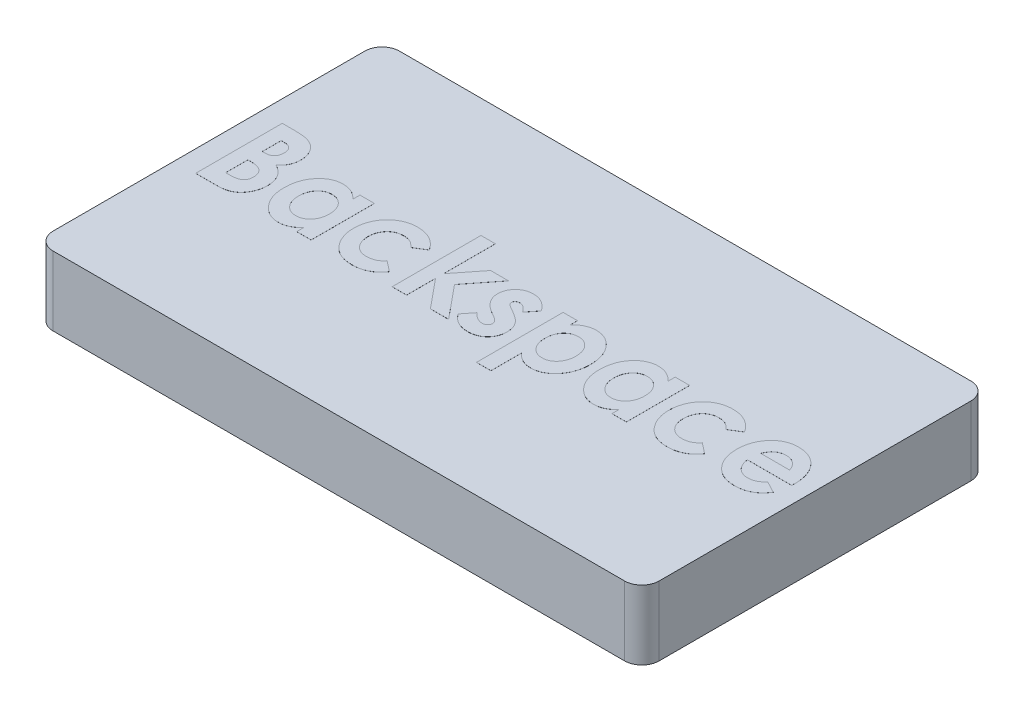
from build123d import *

# Parameters (mm, degrees)
SKETCH1_W           = 22.225
SKETCH1_H           = 12.7
BOSS_EXTRUDE1_DEPTH = 2.54
FILLET1_R           = 0.635
SHELL1_START        = 0.635
SHELL1_OUTLINE_W    = 1.905
SHELL1_OUTLINE_H    = 11.43
SHELL1_DEPTH        = 20.955
SKETCH2_R           = 2.54
BOSS_EXTRUDE2_DEPTH = 1.905
BOSS_EXTRUDE3_DEPTH = 0.00254


# Read off the part's stored shape, not the designer's step: Shell1
with BuildPart() as part:
    # Sketch1 → Boss-Extrude1 (new body)
    with BuildSketch(Plane(origin=(0, 0, 0), x_dir=(1, 0, 0), z_dir=(0, 1, 0))):
        with Locations((11.1125, 6.35)):
            Rectangle(SKETCH1_W, SKETCH1_H)
    extrude(amount=BOSS_EXTRUDE1_DEPTH)

    # Fillet1
    fillet1_edges = [part.edges().sort_by_distance(p)[0] for p in [
        (0, 1.27, -12.7),
        (22.225, 1.27, -12.7),
        (22.225, 1.27, 0),
        (0, 1.27, 0),
    ]]
    fillet(fillet1_edges, radius=FILLET1_R)

    # Shell1 outline → Shell1 (cut)
    with BuildSketch(Plane.YZ.offset(SHELL1_START)):
        with Locations((0.9525, -6.35)):
            Rectangle(SHELL1_OUTLINE_W, SHELL1_OUTLINE_H)
    extrude(amount=SHELL1_DEPTH, mode=Mode.SUBTRACT)

    # Sketch2 → Boss-Extrude2 (add)
    with BuildSketch(Plane(origin=(0, 1.905, 0), x_dir=(-1, 0, 0), z_dir=(0, -1, 0))):
        with Locations(Location((-11.1125, 6.35, 0), (0, 0, 270))):
            Circle(SKETCH2_R)
    extrude(amount=BOSS_EXTRUDE2_DEPTH)

    # Sketch3 → Boss-Extrude3 (add)
    # profile 1 of 9: a face of its own
    with BuildSketch(Plane(origin=(0, 2.54, 0), x_dir=(1, 0, 0), z_dir=(0, 1, 0))):
        with BuildLine():
            Line((0.782841026, 5.08), (0.782841026, 8.255))
            Line((0.782841026, 8.255), (1.210880889, 8.255))
            add(Edge.make_bspline(
                [(1.210880889, 8.255), (1.240777619, 8.255005299), (1.298682144, 8.255015562), (1.382433108, 8.251490649), (1.460032164, 8.24705343), (1.531400749, 8.241896839), (1.596237886, 8.233275143), (1.654880836, 8.224061028), (1.707424578, 8.212855682), (1.739890352, 8.203051523), (1.755311979, 8.198394431)],
                knots=[0, 0, 0, 0, 1.306173942, 2.529821229, 3.661816241, 4.702662712, 5.655173924, 6.518661075, 7.296346443, 8, 8, 8, 8], degree=3))
            add(Edge.make_bspline(
                [(1.755311979, 8.198394431), (1.775378974, 8.191761779), (1.815100305, 8.17863287), (1.871694748, 8.152779306), (1.925325043, 8.123542034), (1.975933674, 8.09038805), (2.023188901, 8.052690357), (2.067027311, 8.010556231), (2.107859777, 7.964618195), (2.145300553, 7.915076365), (2.179021792, 7.862397554), (2.208190527, 7.807004793), (2.233225936, 7.749441384), (2.253603181, 7.689442542), (2.269361457, 7.627107805), (2.281082703, 7.562541121), (2.287168388, 7.49549961), (2.288336777, 7.45002413), (2.288930769, 7.426905048)],
                knots=[0, 0, 0, 0, 1.006077387, 1.991465713, 2.958625327, 3.913741727, 4.869498573, 5.833754035, 6.806591121, 7.794253741, 8.788759311, 9.782598099, 10.773147723, 11.775925239, 12.79729435, 13.833335922, 14.898499088, 16, 16, 16, 16], degree=3))
            add(Edge.make_bspline(
                [(2.288930769, 7.426905048), (2.288040631, 7.39718231), (2.28629014, 7.338731427), (2.273528154, 7.253121297), (2.251604236, 7.171759959), (2.221780494, 7.094017306), (2.181619892, 7.01948078), (2.130133731, 6.948503065), (2.06868991, 6.87884065), (2.021028113, 6.836808266), (1.99636266, 6.81505609)],
                knots=[0, 0, 0, 0, 1.015106322, 1.996244851, 2.948330454, 3.888359469, 4.834477556, 5.831206681, 6.877627938, 8, 8, 8, 8], degree=3))
            add(Edge.make_bspline(
                [(1.99636266, 6.81505609), (2.01728017, 6.803638754), (2.058283763, 6.781257897), (2.116220076, 6.744208913), (2.170036627, 6.705243415), (2.219582485, 6.664266385), (2.264240142, 6.620501045), (2.305352535, 6.575464426), (2.341536564, 6.527647902), (2.384093827, 6.461182911), (2.428156869, 6.371795087), (2.465640754, 6.255730066), (2.488266045, 6.13030481), (2.491032024, 6.043663072), (2.49245641, 5.999045473)],
                knots=[0, 0, 0, 0, 0.848330169, 1.662940995, 2.446604048, 3.213062646, 3.94976172, 4.671337991, 5.382453488, 6.081852935, 7.479510686, 8.916609095, 10.412156767, 12, 12, 12, 12], degree=3))
            add(Edge.make_bspline(
                [(2.49245641, 5.999045473), (2.491001988, 5.955694962), (2.488137531, 5.870316927), (2.465068408, 5.74535742), (2.428358375, 5.625894161), (2.376122763, 5.514320913), (2.313255723, 5.412188276), (2.240350205, 5.322906174), (2.158682092, 5.247336085), (2.083045472, 5.19583697), (2.017531748, 5.161221546), (1.963188576, 5.140429763), (1.905388008, 5.120542355), (1.842316054, 5.106702516), (1.775371881, 5.094248061), (1.703519722, 5.086343871), (1.627549321, 5.081159803), (1.575328345, 5.080392591), (1.54860625, 5.08)],
                knots=[0, 0, 0, 0, 1.393430134, 2.744335056, 4.072854928, 5.403001208, 6.695348278, 7.921150692, 9.098605395, 10.261737545, 10.853399442, 11.477641282, 12.130997377, 12.817392161, 13.551699353, 14.320526973, 15.140593641, 16, 16, 16, 16], degree=3))
            Line((1.54860625, 5.08), (0.782841026, 5.08))
        make_face()
        with BuildLine():
            Line((1.312007692, 7.685128205), (1.312007692, 6.993141026))
            Line((1.312007692, 6.993141026), (1.416314583, 6.993141026))
            add(Edge.make_bspline(
                [(1.416314583, 6.993141026), (1.443582456, 6.993969477), (1.495230197, 6.995538638), (1.56700513, 7.0143817), (1.628359246, 7.044182307), (1.677153799, 7.08763855), (1.714438779, 7.141083893), (1.741364004, 7.203326853), (1.757323201, 7.274315456), (1.758926796, 7.32442076), (1.759764103, 7.350582933)],
                knots=[0, 0, 0, 0, 1.155430212, 2.188486046, 3.126777521, 4.026378417, 4.930788485, 5.874336536, 6.890098034, 8, 8, 8, 8], degree=3))
            add(Edge.make_bspline(
                [(1.759764103, 7.350582933), (1.758922189, 7.37506427), (1.757314992, 7.421798689), (1.741491405, 7.487772571), (1.717045944, 7.546484769), (1.680734962, 7.596127598), (1.634535945, 7.63699427), (1.57703764, 7.6658644), (1.508999216, 7.682196407), (1.460505483, 7.684111461), (1.434759095, 7.685128205)],
                knots=[0, 0, 0, 0, 1.104467184, 2.108407364, 3.048166969, 3.960368024, 4.863467067, 5.810427255, 6.837507733, 8, 8, 8, 8], degree=3))
            Line((1.434759095, 7.685128205), (1.312007692, 7.685128205))
        make_face(mode=Mode.SUBTRACT)
        with BuildLine():
            Line((1.312007692, 6.463974359), (1.312007692, 5.649871795))
            Line((1.312007692, 5.649871795), (1.436667147, 5.649871795))
            add(Edge.make_bspline(
                [(1.436667147, 5.649871795), (1.461477591, 5.650057719), (1.509234685, 5.650415601), (1.577623151, 5.654723602), (1.639588912, 5.66244291), (1.695173814, 5.672227111), (1.744602819, 5.685548736), (1.787704497, 5.701829342), (1.824821537, 5.720770319), (1.864707512, 5.750683762), (1.904926069, 5.796451849), (1.939905512, 5.861843674), (1.959474495, 5.938592434), (1.961974247, 5.992786445), (1.963289744, 6.02130609)],
                knots=[0, 0, 0, 0, 1.201938101, 2.313585023, 3.317513301, 4.226117985, 5.045907792, 5.793682433, 6.455296173, 7.057208093, 8.199375751, 9.375762321, 10.61899269, 12, 12, 12, 12], degree=3))
            add(Edge.make_bspline(
                [(1.963289744, 6.02130609), (1.962931949, 6.038068754), (1.962236778, 6.070637464), (1.956592821, 6.118195259), (1.946257978, 6.162861109), (1.932449761, 6.204930535), (1.914421826, 6.24412627), (1.892677577, 6.280586097), (1.867068035, 6.314675694), (1.837038462, 6.345923889), (1.802469335, 6.374279821), (1.762576145, 6.398433058), (1.717557708, 6.418981222), (1.667043978, 6.435011463), (1.611685667, 6.448754627), (1.55091283, 6.456955118), (1.485129161, 6.463074936), (1.439440101, 6.463666634), (1.415678566, 6.463974359)],
                knots=[0, 0, 0, 0, 0.998956311, 1.940903783, 2.848228916, 3.72731047, 4.57542379, 5.414071263, 6.253099421, 7.111039485, 7.991210135, 8.910076193, 9.882630836, 10.933540472, 12.064436671, 13.277812942, 14.584270601, 16, 16, 16, 16], degree=3))
            Line((1.415678566, 6.463974359), (1.312007692, 6.463974359))
        make_face(mode=Mode.SUBTRACT)
    # profile 2 of 9: a face of its own
    with BuildSketch(Plane(origin=(0, 2.54, 0), x_dir=(1, 0, 0), z_dir=(0, 1, 0))):
        with BuildLine():
            Line((4.487007692, 7.400192308), (5.016174359, 7.400192308))
            Line((5.016174359, 7.400192308), (5.016174359, 5.08))
            Line((5.016174359, 5.08), (4.487007692, 5.08))
            Line((4.487007692, 5.08), (4.487007692, 5.333135016))
            add(Edge.make_bspline(
                [(4.487007692, 5.333135016), (4.461957623, 5.308541962), (4.413554915, 5.261022318), (4.336839144, 5.198859237), (4.259878271, 5.147882497), (4.182591238, 5.10663709), (4.103107734, 5.076732789), (4.021157519, 5.054757072), (3.935768552, 5.041993825), (3.877743853, 5.040200406), (3.848445994, 5.039294872)],
                knots=[0, 0, 0, 0, 1.163382011, 2.247931421, 3.267489461, 4.220113468, 5.145617393, 6.076497093, 7.028783948, 8, 8, 8, 8], degree=3))
            add(Edge.make_bspline(
                [(3.848445994, 5.039294872), (3.815293717, 5.040118195), (3.749831385, 5.041743924), (3.653712509, 5.059369906), (3.560934853, 5.085712858), (3.471764687, 5.123773665), (3.386307179, 5.172616557), (3.303494533, 5.231459579), (3.224921576, 5.301881217), (3.150214437, 5.381525338), (3.082188509, 5.469309774), (3.021767964, 5.563094804), (2.971677952, 5.662873434), (2.930119356, 5.767294668), (2.898226951, 5.877020546), (2.875555639, 5.99193579), (2.861099231, 6.112099948), (2.859575806, 6.194049189), (2.858802564, 6.23564403)],
                knots=[0, 0, 0, 0, 0.921835666, 1.820252405, 2.711136546, 3.602274754, 4.511404282, 5.446462619, 6.424679939, 7.443427837, 8.482233586, 9.511947504, 10.543891267, 11.584974293, 12.636376529, 13.719674099, 14.842578722, 16, 16, 16, 16], degree=3))
            add(Edge.make_bspline(
                [(2.858802564, 6.23564403), (2.859618591, 6.278717935), (2.861218556, 6.363171938), (2.874921209, 6.486929535), (2.896829697, 6.604852641), (2.92820161, 6.716481882), (2.967588437, 6.822541777), (3.016801072, 6.922194511), (3.0739736, 7.016642393), (3.140985028, 7.103029925), (3.213183852, 7.18216236), (3.290374932, 7.251161012), (3.371212259, 7.309836407), (3.456041699, 7.357870386), (3.545186722, 7.394914788), (3.637723303, 7.421713272), (3.73421716, 7.438259131), (3.799830325, 7.440008321), (3.833181571, 7.440897436)],
                knots=[0, 0, 0, 0, 1.196863731, 2.346662879, 3.456089904, 4.526915168, 5.565529373, 6.595904008, 7.611531943, 8.628611739, 9.629449148, 10.585123154, 11.500947365, 12.400650051, 13.288132989, 14.177647946, 15.073696393, 16, 16, 16, 16], degree=3))
            add(Edge.make_bspline(
                [(3.833181571, 7.440897436), (3.863989164, 7.440184959), (3.924905693, 7.438776162), (4.014363738, 7.423217123), (4.10107294, 7.399931913), (4.184596485, 7.366237755), (4.26602107, 7.324669947), (4.342918384, 7.271333921), (4.418319016, 7.21056496), (4.463766751, 7.163074571), (4.487007692, 7.138789063)],
                knots=[0, 0, 0, 0, 0.995162038, 1.96775565, 2.927337147, 3.893531728, 4.874688255, 5.876697576, 6.914191259, 8, 8, 8, 8], degree=3))
            Line((4.487007692, 7.138789063), (4.487007692, 7.400192308))
        make_face()
        with BuildLine():
            add(Edge.make_bspline(
                [(3.952752885, 6.911730769), (3.933013307, 6.911012599), (3.894000493, 6.909593224), (3.83672326, 6.901572449), (3.781856602, 6.886716125), (3.729998703, 6.865581037), (3.680178444, 6.839470208), (3.633704796, 6.806388171), (3.58904503, 6.768438825), (3.547944573, 6.7244873), (3.510719843, 6.676230395), (3.477004137, 6.624771171), (3.450309659, 6.569003151), (3.426576592, 6.510904872), (3.410034189, 6.448813873), (3.397034749, 6.383645573), (3.389407937, 6.315114489), (3.388453709, 6.268311132), (3.387969231, 6.244548277)],
                knots=[0, 0, 0, 0, 0.969811408, 1.916711318, 2.833650388, 3.754071331, 4.662456234, 5.589743238, 6.549778185, 7.536877355, 8.538750444, 9.541056354, 10.551604298, 11.570646859, 12.619111342, 13.70146669, 14.832995853, 16, 16, 16, 16], degree=3))
            add(Edge.make_bspline(
                [(3.387969231, 6.244548277), (3.388446876, 6.22057141), (3.389387751, 6.17334124), (3.397114321, 6.104207762), (3.409771445, 6.038237886), (3.427643681, 5.975665856), (3.450425888, 5.91605871), (3.479205442, 5.860243737), (3.512679668, 5.807501972), (3.550294561, 5.758277743), (3.592258401, 5.713953966), (3.636703501, 5.674783273), (3.684225871, 5.642130049), (3.733970955, 5.615412925), (3.785660503, 5.594069081), (3.839956301, 5.579459526), (3.896477827, 5.570383944), (3.935122267, 5.569107108), (3.954660937, 5.568461538)],
                knots=[0, 0, 0, 0, 1.168729735, 2.302189922, 3.386710167, 4.440198422, 5.470978749, 6.492597328, 7.496227051, 8.513391371, 9.50782408, 10.467539671, 11.396482034, 12.312160972, 13.216215124, 14.11642033, 15.047660069, 16, 16, 16, 16], degree=3))
            add(Edge.make_bspline(
                [(3.954660937, 5.568461538), (3.974826009, 5.569165967), (4.014476233, 5.570551072), (4.072780347, 5.578711312), (4.128533825, 5.593366018), (4.181269044, 5.61454245), (4.231519168, 5.641023378), (4.279532104, 5.672632016), (4.324032517, 5.711415602), (4.366009246, 5.755078383), (4.403771647, 5.803787045), (4.437205744, 5.856277018), (4.465261387, 5.912574407), (4.488059067, 5.972482073), (4.505990018, 6.035898998), (4.51855197, 6.102946401), (4.526320675, 6.17355483), (4.527242803, 6.221843247), (4.527712821, 6.24645633)],
                knots=[0, 0, 0, 0, 0.973494368, 1.914164832, 2.835034228, 3.749055219, 4.650792206, 5.573195486, 6.516644894, 7.49373616, 8.49266101, 9.486277843, 10.493086248, 11.523132543, 12.575953654, 13.669751989, 14.812249585, 16, 16, 16, 16], degree=3))
            add(Edge.make_bspline(
                [(4.527712821, 6.24645633), (4.527251134, 6.270646138), (4.526349638, 6.317879453), (4.518522887, 6.387007312), (4.505867123, 6.45274862), (4.488317428, 6.515024642), (4.465114032, 6.573533546), (4.437015791, 6.628486609), (4.403982613, 6.680198608), (4.365764786, 6.727699544), (4.324076466, 6.770763522), (4.279322172, 6.808802464), (4.231391282, 6.840553988), (4.181042153, 6.86708282), (4.127609235, 6.886484715), (4.071982738, 6.901661053), (4.013188548, 6.909600398), (3.973125303, 6.911012637), (3.952752885, 6.911730769)],
                knots=[0, 0, 0, 0, 1.177928123, 2.300036839, 3.38351634, 4.435993631, 5.446552242, 6.444100992, 7.438062291, 8.429875644, 9.408429948, 10.353784422, 11.284588866, 12.203691864, 13.118608642, 14.047865231, 15.007326911, 16, 16, 16, 16], degree=3))
        make_face(mode=Mode.SUBTRACT)
    # profile 3 of 9: a face of its own
    with BuildSketch(Plane(origin=(0, 2.54, 0), x_dir=(1, 0, 0), z_dir=(0, 1, 0))):
        with BuildLine():
            Line((7.499187179, 6.926995192), (7.081959615, 6.6675))
            add(Edge.make_bspline(
                [(7.081959615, 6.6675), (7.06287843, 6.689114788), (7.026397653, 6.730439488), (6.967386507, 6.783222067), (6.909619485, 6.826868422), (6.850283446, 6.859276876), (6.789158517, 6.883405862), (6.723948059, 6.899750223), (6.654047099, 6.910197902), (6.605621553, 6.911211012), (6.580777724, 6.911730769)],
                knots=[0, 0, 0, 0, 1.194303875, 2.283355759, 3.276580192, 4.189182302, 5.077070842, 5.993727104, 6.970718852, 8, 8, 8, 8], degree=3))
            add(Edge.make_bspline(
                [(6.580777724, 6.911730769), (6.557848362, 6.911116331), (6.513083846, 6.909916776), (6.447523274, 6.900620316), (6.385146921, 6.886391524), (6.326154245, 6.865358745), (6.27103274, 6.83739963), (6.218767081, 6.80454651), (6.169928676, 6.765254464), (6.125217737, 6.720242811), (6.084602712, 6.670931043), (6.049270691, 6.61761034), (6.019670371, 6.560974004), (5.99419656, 6.501223792), (5.975487168, 6.437775347), (5.962211721, 6.370919968), (5.953611603, 6.300954393), (5.952803871, 6.253054319), (5.952392308, 6.228647837)],
                knots=[0, 0, 0, 0, 1.055507124, 2.060644499, 3.04339101, 3.997597527, 4.936295645, 5.88423876, 6.835644371, 7.815914652, 8.800937668, 9.77300634, 10.755607363, 11.740146458, 12.759408235, 13.795227115, 14.876603977, 16, 16, 16, 16], degree=3))
            add(Edge.make_bspline(
                [(5.952392308, 6.228647837), (5.952841785, 6.204878426), (5.953719106, 6.158483697), (5.961732873, 6.090460999), (5.973871974, 6.025564442), (5.992942783, 5.964342285), (6.015221552, 5.905929954), (6.044729502, 5.851795771), (6.077300196, 5.799778123), (6.116316532, 5.752303279), (6.159245932, 5.709400888), (6.205387882, 5.671249023), (6.255063724, 5.639255877), (6.308356329, 5.614086162), (6.364172437, 5.593235489), (6.423472182, 5.578644058), (6.486210815, 5.570537629), (6.529025665, 5.569163238), (6.550884896, 5.568461538)],
                knots=[0, 0, 0, 0, 1.138892009, 2.222965831, 3.27924816, 4.298360244, 5.292854937, 6.27022401, 7.248385224, 8.230812959, 9.208076365, 10.154034703, 11.095561274, 12.031863364, 12.973883383, 13.947441211, 14.952060877, 16, 16, 16, 16], degree=3))
            add(Edge.make_bspline(
                [(6.550884896, 5.568461538), (6.577853097, 5.569154587), (6.630559431, 5.570509073), (6.707332432, 5.582257036), (6.779552129, 5.601095083), (6.847025809, 5.628091944), (6.909879926, 5.662644601), (6.968042248, 5.705085228), (7.022127004, 5.754668431), (7.052971091, 5.793176138), (7.068603245, 5.812692308)],
                knots=[0, 0, 0, 0, 1.087586428, 2.125566055, 3.125668057, 4.09304163, 5.050187411, 6.011795079, 6.992353802, 8, 8, 8, 8], degree=3))
            Line((7.068603245, 5.812692308), (7.458482051, 5.508675881))
            add(Edge.make_bspline(
                [(7.458482051, 5.508675881), (7.4311692, 5.471272245), (7.377656557, 5.397989256), (7.283649294, 5.302176395), (7.182184004, 5.22032791), (7.071419963, 5.154489347), (6.952772246, 5.102333638), (6.825545439, 5.065619419), (6.690080059, 5.043728109), (6.597184531, 5.040796265), (6.549612861, 5.039294872)],
                knots=[0, 0, 0, 0, 1.039868462, 2.037359943, 3.00707792, 3.962440096, 4.924824084, 5.912581365, 6.931035832, 8, 8, 8, 8], degree=3))
            add(Edge.make_bspline(
                [(6.549612861, 5.039294872), (6.506736973, 5.040406872), (6.422986679, 5.042578962), (6.301001357, 5.059129209), (6.186203064, 5.087383774), (6.078194815, 5.125878712), (5.977487227, 5.176383546), (5.88468875, 5.23900043), (5.798319812, 5.311532118), (5.720639852, 5.395051066), (5.651220979, 5.485759156), (5.589940268, 5.580865492), (5.538848776, 5.68029887), (5.496728314, 5.783072509), (5.463280715, 5.889809558), (5.44008379, 6.000568258), (5.425542647, 6.115047596), (5.424004689, 6.192562827), (5.423225641, 6.231827925)],
                knots=[0, 0, 0, 0, 1.119149545, 2.186056245, 3.206287529, 4.200745281, 5.173526272, 6.139100442, 7.117079434, 8.111660401, 9.110222197, 10.095923489, 11.061354878, 12.024435272, 12.992528438, 13.977125808, 14.975319392, 16, 16, 16, 16], degree=3))
            add(Edge.make_bspline(
                [(5.423225641, 6.231827925), (5.423817271, 6.259186734), (5.424988312, 6.313339252), (5.431225321, 6.393876944), (5.442649625, 6.472928277), (5.459353538, 6.550119742), (5.4797376, 6.625763659), (5.504475879, 6.699810452), (5.534491298, 6.772139181), (5.568676598, 6.842779748), (5.607419047, 6.910376316), (5.64934662, 6.974973978), (5.695260047, 7.035551932), (5.744949481, 7.092140992), (5.798107884, 7.145191667), (5.854413147, 7.195042872), (5.915387291, 7.239900928), (5.978690076, 7.282175305), (6.045301313, 7.319463036), (6.114139617, 7.352010138), (6.184907435, 7.37950188), (6.257714256, 7.401526166), (6.332115274, 7.419850066), (6.408782499, 7.431356687), (6.487106887, 7.439533869), (6.540050574, 7.440439914), (6.566785337, 7.440897436)],
                knots=[0, 0, 0, 0, 1.060056762, 2.098217867, 3.127372312, 4.151927895, 5.156132648, 6.161311037, 7.174111614, 8.187977387, 9.199611623, 10.190595683, 11.169662846, 12.141676319, 13.105780171, 14.077793643, 15.051921661, 16.036040289, 17.025286885, 18.006281483, 18.984004081, 19.963484586, 20.951605312, 21.949508978, 22.964571759, 24, 24, 24, 24], degree=3))
            add(Edge.make_bspline(
                [(6.566785337, 7.440897436), (6.5916029, 7.440579147), (6.640686558, 7.439949642), (6.71314846, 7.43349609), (6.783602599, 7.422485466), (6.852189472, 7.407870109), (6.919360825, 7.389747031), (6.983995716, 7.365989225), (7.046752815, 7.338355051), (7.127907613, 7.297204846), (7.223515256, 7.235288957), (7.32814676, 7.146937624), (7.421272438, 7.043812951), (7.472986621, 6.966277753), (7.499187179, 6.926995192)],
                knots=[0, 0, 0, 0, 0.801484189, 1.585158681, 2.34738599, 3.103559859, 3.849525029, 4.59256119, 5.325429611, 6.063526497, 7.529967051, 8.992516966, 10.476283855, 12, 12, 12, 12], degree=3))
        make_face()
    # profile 4 of 9: a face of its own
    with BuildSketch(Plane(origin=(0, 2.54, 0), x_dir=(1, 0, 0), z_dir=(0, 1, 0))):
        Polygon((7.987648718, 8.336410256), (8.516815385, 8.336410256), (8.516815385, 6.437261619), (9.27685645, 7.400192308), (9.933226643, 7.400192308), (9.060610457, 6.294157652), (10.058522115, 5.08), (9.390067588, 5.08), (8.516815385, 6.142785457), (8.516815385, 5.08), (7.987648718, 5.08), align=None)
    # profile 5 of 9: a face of its own
    with BuildSketch(Plane(origin=(0, 2.54, 0), x_dir=(1, 0, 0), z_dir=(0, 1, 0))):
        with BuildLine():
            Line((11.488289744, 7.042114383), (11.185545353, 6.6675))
            add(Edge.make_bspline(
                [(11.185545353, 6.6675), (11.170491241, 6.686749916), (11.141748154, 6.723504128), (11.097235569, 6.773549475), (11.053360546, 6.81531515), (11.011274831, 6.850730126), (10.969372104, 6.877277451), (10.928812198, 6.897079739), (10.889019077, 6.909307116), (10.862523672, 6.910941476), (10.849728045, 6.911730769)],
                knots=[0, 0, 0, 0, 1.368660567, 2.613208372, 3.747062795, 4.759710206, 5.688691635, 6.517303616, 7.283950149, 8, 8, 8, 8], degree=3))
            add(Edge.make_bspline(
                [(10.849728045, 6.911730769), (10.836748999, 6.911308508), (10.812025254, 6.910504145), (10.776996297, 6.902636109), (10.746056971, 6.890268238), (10.720287284, 6.872078079), (10.699779402, 6.850398735), (10.684705833, 6.826000837), (10.676124194, 6.798642553), (10.674848376, 6.779710452), (10.674187179, 6.769898838)],
                knots=[0, 0, 0, 0, 1.229796002, 2.342634756, 3.388738777, 4.370994693, 5.310284858, 6.203868213, 7.06914966, 8, 8, 8, 8], degree=3))
            add(Edge.make_bspline(
                [(10.674187179, 6.769898838), (10.6757628, 6.755022975), (10.678979496, 6.724653264), (10.699232566, 6.688608774), (10.726625763, 6.661467439), (10.758215907, 6.636758636), (10.801082689, 6.609411728), (10.833344152, 6.590228235), (10.85100008, 6.579729567)],
                knots=[0, 0, 0, 0, 0.980372538, 2.001472502, 2.644932243, 3.521580606, 4.643620239, 6, 6, 6, 6], degree=3))
            Line((10.85100008, 6.579729567), (11.030993069, 6.475422676))
            add(Edge.make_bspline(
                [(11.030993069, 6.475422676), (11.05406218, 6.462132155), (11.09874096, 6.436391923), (11.160891046, 6.394413297), (11.218614839, 6.353892335), (11.270859598, 6.312958824), (11.316668407, 6.270547701), (11.357586717, 6.228822155), (11.392822203, 6.186800771), (11.43203104, 6.130371687), (11.471871777, 6.055830338), (11.504599845, 5.959084117), (11.526006774, 5.855607486), (11.527981015, 5.783970911), (11.528994872, 5.747182492)],
                knots=[0, 0, 0, 0, 1.026311994, 1.987695542, 2.890533907, 3.745971882, 4.54447292, 5.296063004, 5.998421597, 6.656110558, 7.9434731, 9.241357562, 10.583320098, 12, 12, 12, 12], degree=3))
            add(Edge.make_bspline(
                [(11.528994872, 5.747182492), (11.528415458, 5.722346137), (11.527281852, 5.673754598), (11.517438645, 5.602397052), (11.50145156, 5.534346624), (11.480088866, 5.468854383), (11.451143048, 5.406931706), (11.41589516, 5.348340999), (11.375072742, 5.292322326), (11.327318705, 5.240746669), (11.275221934, 5.193042296), (11.21765093, 5.151923597), (11.156189561, 5.116829508), (11.089825595, 5.088917361), (11.019837054, 5.066543277), (10.94528898, 5.050674279), (10.86651902, 5.041041365), (10.81244286, 5.039884886), (10.784854247, 5.039294872)],
                knots=[0, 0, 0, 0, 1.032995144, 2.021022227, 2.990285581, 3.938693397, 4.881918393, 5.827409225, 6.78011452, 7.760353803, 8.747120044, 9.714092799, 10.697699863, 11.685687568, 12.703926778, 13.750652644, 14.852426407, 16, 16, 16, 16], degree=3))
            add(Edge.make_bspline(
                [(10.784854247, 5.039294872), (10.748108205, 5.040580104), (10.676082601, 5.043099278), (10.570824806, 5.061040644), (10.47143556, 5.091750832), (10.377740108, 5.134964812), (10.289145867, 5.189659889), (10.207802827, 5.25843195), (10.130193866, 5.337166374), (10.086163651, 5.398008695), (10.063610256, 5.429173678)],
                knots=[0, 0, 0, 0, 1.030618814, 2.020107139, 2.985146026, 3.940533544, 4.907604537, 5.896019858, 6.92228791, 8, 8, 8, 8], degree=3))
            Line((10.063610256, 5.429173678), (10.368898718, 5.812692308))
            add(Edge.make_bspline(
                [(10.368898718, 5.812692308), (10.383548197, 5.794929066), (10.412626341, 5.759670332), (10.463134989, 5.713727243), (10.515621133, 5.671123563), (10.571725101, 5.635510761), (10.627963705, 5.606520123), (10.682061006, 5.585370823), (10.732862564, 5.571477924), (10.76590994, 5.569435712), (10.781674159, 5.568461538)],
                knots=[0, 0, 0, 0, 1.119500597, 2.222126707, 3.316607371, 4.407432039, 5.450634987, 6.391729787, 7.232824889, 8, 8, 8, 8], degree=3))
            add(Edge.make_bspline(
                [(10.781674159, 5.568461538), (10.797208484, 5.56897839), (10.827160572, 5.569974942), (10.869756453, 5.580228588), (10.907492009, 5.597735285), (10.939719364, 5.621411929), (10.966736488, 5.64878621), (10.985125355, 5.680028493), (10.997816887, 5.712736818), (10.999152831, 5.735616087), (10.999828205, 5.747182492)],
                knots=[0, 0, 0, 0, 1.188688593, 2.291937639, 3.331258834, 4.354844428, 5.343010125, 6.254053882, 7.117352921, 8, 8, 8, 8], degree=3))
            add(Edge.make_bspline(
                [(10.999828205, 5.747182492), (10.9992492, 5.758076978), (10.99806626, 5.780335026), (10.986919503, 5.813171399), (10.970192435, 5.846065893), (10.946289629, 5.878615159), (10.915203162, 5.910286738), (10.878061588, 5.942026088), (10.834741636, 5.974128587), (10.802427152, 5.993397987), (10.785490264, 6.003497596)],
                knots=[0, 0, 0, 0, 0.747819068, 1.527836475, 2.363222863, 3.282707394, 4.294171961, 5.411668418, 6.643385968, 8, 8, 8, 8], degree=3))
            Line((10.785490264, 6.003497596), (10.620125681, 6.09890024))
            add(Edge.make_bspline(
                [(10.620125681, 6.09890024), (10.582540788, 6.121924336), (10.510035601, 6.166340224), (10.412862444, 6.242309088), (10.330420665, 6.322767474), (10.263076766, 6.407824748), (10.209526563, 6.497057766), (10.172788775, 6.591516037), (10.14936086, 6.690109187), (10.146477883, 6.757471288), (10.145020513, 6.791523438)],
                knots=[0, 0, 0, 0, 1.198661262, 2.312342847, 3.348540627, 4.326131918, 5.257181173, 6.168868325, 7.074346411, 8, 8, 8, 8], degree=3))
            add(Edge.make_bspline(
                [(10.145020513, 6.791523438), (10.145713838, 6.813596234), (10.147072055, 6.856836565), (10.155352702, 6.920591008), (10.169862524, 6.981852745), (10.191260208, 7.040399535), (10.217349923, 7.097084218), (10.249769789, 7.151033899), (10.288552871, 7.202225401), (10.331882636, 7.250805132), (10.380024533, 7.295410215), (10.432330524, 7.333946972), (10.487298959, 7.367780588), (10.546259667, 7.394197096), (10.608124849, 7.415533165), (10.673657834, 7.429912593), (10.742198021, 7.438998534), (10.789065271, 7.440258373), (10.812839022, 7.440897436)],
                knots=[0, 0, 0, 0, 1.018774773, 1.995766957, 2.961671996, 3.91801437, 4.867928154, 5.837839166, 6.816300144, 7.827954982, 8.838947153, 9.838941932, 10.822283044, 11.811835611, 12.814364266, 13.837452721, 14.903032216, 16, 16, 16, 16], degree=3))
            add(Edge.make_bspline(
                [(10.812839022, 7.440897436), (10.845789273, 7.439685335), (10.91119089, 7.437279484), (11.00761785, 7.417592683), (11.100681628, 7.384601978), (11.190439029, 7.339299695), (11.275541216, 7.282122702), (11.354399726, 7.213389499), (11.426411015, 7.133250273), (11.467353037, 7.072950269), (11.488289744, 7.042114383)],
                knots=[0, 0, 0, 0, 0.964884164, 1.915159476, 2.870012697, 3.850705445, 4.853461725, 5.866212692, 6.908835527, 8, 8, 8, 8], degree=3))
        make_face()
    # profile 6 of 9: a face of its own
    with BuildSketch(Plane(origin=(0, 2.54, 0), x_dir=(1, 0, 0), z_dir=(0, 1, 0))):
        with BuildLine():
            Line((12.465212821, 7.400192308), (12.465212821, 7.138789063))
            add(Edge.make_bspline(
                [(12.465212821, 7.138789063), (12.488669538, 7.163073483), (12.534553561, 7.210576589), (12.610559391, 7.271394062), (12.687898474, 7.324307692), (12.769008332, 7.366415786), (12.852613323, 7.400028204), (12.939575908, 7.423125095), (13.029009954, 7.438754543), (13.089715072, 7.44017933), (13.120310978, 7.440897436)],
                knots=[0, 0, 0, 0, 1.089368188, 2.130928821, 3.137420444, 4.111338209, 5.076382318, 6.041426427, 7.012861947, 8, 8, 8, 8], degree=3))
            add(Edge.make_bspline(
                [(13.120310978, 7.440897436), (13.15366312, 7.440010458), (13.219278048, 7.438265474), (13.31575904, 7.421688938), (13.408155539, 7.395059566), (13.496951152, 7.357694395), (13.581661065, 7.309865058), (13.662448344, 7.251126604), (13.739688894, 7.182372707), (13.811200975, 7.102801405), (13.878263113, 7.016667442), (13.935477896, 6.922210165), (13.984409763, 6.822384414), (14.025032169, 6.716743853), (14.055119106, 6.604712853), (14.077378691, 6.486953194), (14.090980852, 6.363165648), (14.092594794, 6.278715811), (14.093417949, 6.23564403)],
                knots=[0, 0, 0, 0, 0.926819241, 1.823366479, 2.713376591, 3.595915486, 4.496118997, 5.412453008, 6.368658997, 7.366071271, 8.383717232, 9.399910524, 10.430858724, 11.472139475, 12.54198624, 13.652030834, 14.802470027, 16, 16, 16, 16], degree=3))
            add(Edge.make_bspline(
                [(14.093417949, 6.23564403), (14.092644705, 6.19404919), (14.091121279, 6.112099951), (14.076664885, 5.991935777), (14.053993519, 5.877020594), (14.022101311, 5.767294495), (13.980541993, 5.662874073), (13.930454649, 5.563092442), (13.870024152, 5.469318602), (13.802035427, 5.381492336), (13.727302222, 5.302115074), (13.649333895, 5.231253813), (13.566523509, 5.172645641), (13.481098529, 5.123766139), (13.391919927, 5.085714844), (13.299144406, 5.059369419), (13.203234327, 5.041782186), (13.137985895, 5.040129298), (13.105046554, 5.039294872)],
                knots=[0, 0, 0, 0, 1.158166885, 2.281794878, 3.365790304, 4.417869849, 5.459623537, 6.492232074, 7.52260933, 8.562084273, 9.581488445, 10.555926241, 11.491586939, 12.401302125, 13.2930144, 14.184472446, 15.083467941, 16, 16, 16, 16], degree=3))
            add(Edge.make_bspline(
                [(13.105046554, 5.039294872), (13.075731648, 5.040102124), (13.017850683, 5.041696006), (12.932678902, 5.055855018), (12.850109878, 5.07699642), (12.770285244, 5.108743292), (12.692494867, 5.150712019), (12.61573042, 5.203813245), (12.538489942, 5.267246933), (12.490198871, 5.316536556), (12.465212821, 5.342039263)],
                knots=[0, 0, 0, 0, 0.963305484, 1.902003389, 2.832040647, 3.761555176, 4.719117085, 5.732363383, 6.826713052, 8, 8, 8, 8], degree=3))
            Line((12.465212821, 5.342039263), (12.465212821, 4.225192308))
            Line((12.465212821, 4.225192308), (11.936046154, 4.225192308))
            Line((11.936046154, 4.225192308), (11.936046154, 7.400192308))
            Line((11.936046154, 7.400192308), (12.465212821, 7.400192308))
        make_face()
        with BuildLine():
            add(Edge.make_bspline(
                [(12.997559575, 6.911730769), (12.977398256, 6.911016558), (12.937755408, 6.909612217), (12.879397772, 6.901591543), (12.82398898, 6.886462515), (12.770666556, 6.867247787), (12.720719867, 6.840358855), (12.67288526, 6.808827525), (12.628147712, 6.770756502), (12.586454716, 6.727701481), (12.548238173, 6.680198085), (12.515204649, 6.62848675), (12.4871065, 6.573533507), (12.463903079, 6.515024653), (12.446353392, 6.452748617), (12.433697626, 6.387007313), (12.425870875, 6.317879453), (12.424969379, 6.270646138), (12.424507692, 6.24645633)],
                knots=[0, 0, 0, 0, 0.984187084, 1.935189732, 2.86617382, 3.782791437, 4.694432968, 5.626967787, 6.574079685, 7.554453132, 8.548110275, 9.543919359, 10.543322562, 11.555759812, 12.610193668, 13.695687369, 14.819882097, 16, 16, 16, 16], degree=3))
            add(Edge.make_bspline(
                [(12.424507692, 6.24645633), (12.42497771, 6.221843247), (12.425899838, 6.17355483), (12.433668542, 6.102946401), (12.446230494, 6.035898998), (12.464161446, 5.972482073), (12.486959126, 5.912574407), (12.515014769, 5.856277018), (12.548448865, 5.803787045), (12.586211267, 5.755078383), (12.628187996, 5.711415602), (12.672688409, 5.672632016), (12.720701345, 5.641023378), (12.770951469, 5.61454245), (12.823686687, 5.593366018), (12.879440166, 5.578711312), (12.93774428, 5.570551072), (12.977394504, 5.569165967), (12.997559575, 5.568461538)],
                knots=[0, 0, 0, 0, 1.187750415, 2.330248011, 3.424046346, 4.476867457, 5.506913752, 6.513722157, 7.50733899, 8.50626384, 9.483355106, 10.426804514, 11.349207794, 12.250944781, 13.164965772, 14.085835168, 15.026505632, 16, 16, 16, 16], degree=3))
            add(Edge.make_bspline(
                [(12.997559575, 5.568461538), (13.017098375, 5.569106919), (13.05574307, 5.570383382), (13.112262732, 5.579461684), (13.166565367, 5.594061271), (13.21822933, 5.615442415), (13.267917694, 5.641935628), (13.314941104, 5.675004434), (13.359331602, 5.713932671), (13.401345409, 5.75824966), (13.438742092, 5.807730219), (13.473312995, 5.859842047), (13.500797816, 5.916418386), (13.524823056, 5.975477381), (13.542374605, 6.038269592), (13.555127285, 6.104198781), (13.562827196, 6.17334361), (13.563771763, 6.220572207), (13.564251282, 6.244548277)],
                knots=[0, 0, 0, 0, 0.95256658, 1.884027947, 2.784447395, 3.688716704, 4.604613566, 5.525282879, 6.485226874, 7.47989625, 8.497302648, 9.506745809, 10.523942064, 11.558744846, 12.612483823, 13.697262175, 14.830992116, 16, 16, 16, 16], degree=3))
            add(Edge.make_bspline(
                [(13.564251282, 6.244548277), (13.563766804, 6.268311132), (13.562812576, 6.315114489), (13.555185763, 6.383645572), (13.542186326, 6.448813876), (13.525643915, 6.510904861), (13.501910874, 6.569003191), (13.475216299, 6.624771022), (13.441500954, 6.676230946), (13.404274888, 6.724485256), (13.363179299, 6.768446241), (13.318502101, 6.80636171), (13.271937784, 6.839673806), (13.221702107, 6.865394315), (13.16956577, 6.886871761), (13.11440653, 6.901467877), (13.056743643, 6.909645496), (13.017513626, 6.911027715), (12.997559575, 6.911730769)],
                knots=[0, 0, 0, 0, 1.164844956, 2.294280565, 3.374633339, 4.421157953, 5.438315082, 6.44699331, 7.447444755, 8.447464179, 9.432737018, 10.390995709, 11.316567047, 12.232458558, 13.151176538, 14.076456035, 15.021603992, 16, 16, 16, 16], degree=3))
        make_face(mode=Mode.SUBTRACT)
    # profile 7 of 9: a face of its own
    with BuildSketch(Plane(origin=(0, 2.54, 0), x_dir=(1, 0, 0), z_dir=(0, 1, 0))):
        with BuildLine():
            Line((16.047264103, 7.400192308), (16.576430769, 7.400192308))
            Line((16.576430769, 7.400192308), (16.576430769, 5.08))
            Line((16.576430769, 5.08), (16.047264103, 5.08))
            Line((16.047264103, 5.08), (16.047264103, 5.333135016))
            add(Edge.make_bspline(
                [(16.047264103, 5.333135016), (16.022214033, 5.308541962), (15.973811325, 5.261022318), (15.897095554, 5.198859237), (15.820134681, 5.147882497), (15.742847648, 5.10663709), (15.663364144, 5.076732789), (15.58141393, 5.054757072), (15.496024962, 5.041993825), (15.438000264, 5.040200406), (15.408702404, 5.039294872)],
                knots=[0, 0, 0, 0, 1.163382011, 2.247931421, 3.267489461, 4.220113468, 5.145617393, 6.076497093, 7.028783948, 8, 8, 8, 8], degree=3))
            add(Edge.make_bspline(
                [(15.408702404, 5.039294872), (15.375550127, 5.040118195), (15.310087796, 5.041743924), (15.213968919, 5.059369906), (15.121191263, 5.085712858), (15.032021097, 5.123773665), (14.946563589, 5.172616557), (14.863750943, 5.231459579), (14.785177986, 5.301881217), (14.710470847, 5.381525338), (14.64244492, 5.469309774), (14.582024375, 5.563094804), (14.531934362, 5.662873434), (14.490375766, 5.767294668), (14.458483361, 5.877020546), (14.43581205, 5.99193579), (14.421355641, 6.112099948), (14.419832217, 6.194049189), (14.419058974, 6.23564403)],
                knots=[0, 0, 0, 0, 0.921835666, 1.820252405, 2.711136546, 3.602274754, 4.511404282, 5.446462619, 6.424679939, 7.443427837, 8.482233586, 9.511947504, 10.543891267, 11.584974293, 12.636376529, 13.719674099, 14.842578722, 16, 16, 16, 16], degree=3))
            add(Edge.make_bspline(
                [(14.419058974, 6.23564403), (14.419875001, 6.278717935), (14.421474966, 6.363171938), (14.435177619, 6.486929535), (14.457086108, 6.604852641), (14.48845802, 6.716481882), (14.527844847, 6.822541777), (14.577057482, 6.922194511), (14.63423001, 7.016642393), (14.701241439, 7.103029925), (14.773440262, 7.18216236), (14.850631342, 7.251161012), (14.931468669, 7.309836407), (15.016298109, 7.357870386), (15.105443133, 7.394914788), (15.197979713, 7.421713272), (15.29447357, 7.438259131), (15.360086735, 7.440008321), (15.393437981, 7.440897436)],
                knots=[0, 0, 0, 0, 1.196863731, 2.346662879, 3.456089904, 4.526915168, 5.565529373, 6.595904008, 7.611531943, 8.628611739, 9.629449148, 10.585123154, 11.500947365, 12.400650051, 13.288132989, 14.177647946, 15.073696393, 16, 16, 16, 16], degree=3))
            add(Edge.make_bspline(
                [(15.393437981, 7.440897436), (15.424245575, 7.440184959), (15.485162104, 7.438776162), (15.574620148, 7.423217123), (15.66132935, 7.399931913), (15.744852896, 7.366237755), (15.82627748, 7.324669947), (15.903174794, 7.271333921), (15.978575426, 7.21056496), (16.024023161, 7.163074571), (16.047264103, 7.138789063)],
                knots=[0, 0, 0, 0, 0.995162038, 1.96775565, 2.927337147, 3.893531728, 4.874688255, 5.876697576, 6.914191259, 8, 8, 8, 8], degree=3))
            Line((16.047264103, 7.138789063), (16.047264103, 7.400192308))
        make_face()
        with BuildLine():
            add(Edge.make_bspline(
                [(15.513009295, 6.911730769), (15.493269717, 6.911012599), (15.454256903, 6.909593224), (15.396979671, 6.901572449), (15.342113012, 6.886716125), (15.290255114, 6.865581037), (15.240434855, 6.839470208), (15.193961206, 6.806388171), (15.14930144, 6.768438825), (15.108200983, 6.7244873), (15.070976253, 6.676230395), (15.037260547, 6.624771171), (15.01056607, 6.569003151), (14.986833002, 6.510904872), (14.970290599, 6.448813873), (14.95729116, 6.383645573), (14.949664347, 6.315114489), (14.948710119, 6.268311132), (14.948225641, 6.244548277)],
                knots=[0, 0, 0, 0, 0.969811408, 1.916711318, 2.833650388, 3.754071331, 4.662456234, 5.589743238, 6.549778185, 7.536877355, 8.538750444, 9.541056354, 10.551604298, 11.570646859, 12.619111342, 13.70146669, 14.832995853, 16, 16, 16, 16], degree=3))
            add(Edge.make_bspline(
                [(14.948225641, 6.244548277), (14.948703286, 6.22057141), (14.949644162, 6.17334124), (14.957370732, 6.104207762), (14.970027855, 6.038237886), (14.987900091, 5.975665856), (15.010682298, 5.91605871), (15.039461852, 5.860243737), (15.072936079, 5.807501972), (15.110550972, 5.758277743), (15.152514811, 5.713953966), (15.196959911, 5.674783273), (15.244482281, 5.642130049), (15.294227365, 5.615412925), (15.345916913, 5.594069081), (15.400212711, 5.579459526), (15.456734238, 5.570383944), (15.495378677, 5.569107108), (15.514917348, 5.568461538)],
                knots=[0, 0, 0, 0, 1.168729735, 2.302189922, 3.386710167, 4.440198422, 5.470978749, 6.492597328, 7.496227051, 8.513391371, 9.50782408, 10.467539671, 11.396482034, 12.312160972, 13.216215124, 14.11642033, 15.047660069, 16, 16, 16, 16], degree=3))
            add(Edge.make_bspline(
                [(15.514917348, 5.568461538), (15.535082419, 5.569165967), (15.574732643, 5.570551072), (15.633036757, 5.578711312), (15.688790236, 5.593366018), (15.741525454, 5.61454245), (15.791775578, 5.641023378), (15.839788514, 5.672632016), (15.884288927, 5.711415602), (15.926265656, 5.755078383), (15.964028058, 5.803787045), (15.997462154, 5.856277018), (16.025517797, 5.912574407), (16.048315477, 5.972482073), (16.066246429, 6.035898998), (16.078808381, 6.102946401), (16.086577085, 6.17355483), (16.087499213, 6.221843247), (16.087969231, 6.24645633)],
                knots=[0, 0, 0, 0, 0.973494368, 1.914164832, 2.835034228, 3.749055219, 4.650792206, 5.573195486, 6.516644894, 7.49373616, 8.49266101, 9.486277843, 10.493086248, 11.523132543, 12.575953654, 13.669751989, 14.812249585, 16, 16, 16, 16], degree=3))
            add(Edge.make_bspline(
                [(16.087969231, 6.24645633), (16.087507544, 6.270646138), (16.086606049, 6.317879453), (16.078779297, 6.387007312), (16.066123533, 6.45274862), (16.048573839, 6.515024642), (16.025370443, 6.573533546), (15.997272201, 6.628486609), (15.964239024, 6.680198608), (15.926021196, 6.727699544), (15.884332876, 6.770763522), (15.839578582, 6.808802464), (15.791647692, 6.840553988), (15.741298563, 6.86708282), (15.687865646, 6.886484715), (15.632239148, 6.901661053), (15.573444958, 6.909600398), (15.533381713, 6.911012637), (15.513009295, 6.911730769)],
                knots=[0, 0, 0, 0, 1.177928123, 2.300036839, 3.38351634, 4.435993631, 5.446552242, 6.444100992, 7.438062291, 8.429875644, 9.408429948, 10.353784422, 11.284588866, 12.203691864, 13.118608642, 14.047865231, 15.007326911, 16, 16, 16, 16], degree=3))
        make_face(mode=Mode.SUBTRACT)
    # profile 8 of 9: a face of its own
    with BuildSketch(Plane(origin=(0, 2.54, 0), x_dir=(1, 0, 0), z_dir=(0, 1, 0))):
        with BuildLine():
            Line((19.05944359, 6.926995192), (18.642216026, 6.6675))
            add(Edge.make_bspline(
                [(18.642216026, 6.6675), (18.623134841, 6.689114788), (18.586654063, 6.730439488), (18.527642917, 6.783222067), (18.469875895, 6.826868422), (18.410539856, 6.859276876), (18.349414927, 6.883405862), (18.28420447, 6.899750223), (18.214303509, 6.910197902), (18.165877964, 6.911211012), (18.141034135, 6.911730769)],
                knots=[0, 0, 0, 0, 1.194303875, 2.283355759, 3.276580192, 4.189182302, 5.077070842, 5.993727104, 6.970718852, 8, 8, 8, 8], degree=3))
            add(Edge.make_bspline(
                [(18.141034135, 6.911730769), (18.118104772, 6.911116331), (18.073340256, 6.909916776), (18.007779685, 6.900620316), (17.945403331, 6.886391524), (17.886410655, 6.865358745), (17.83128915, 6.83739963), (17.779023491, 6.80454651), (17.730185087, 6.765254464), (17.685474147, 6.720242811), (17.644859123, 6.670931043), (17.609527101, 6.61761034), (17.579926781, 6.560974004), (17.55445297, 6.501223792), (17.535743579, 6.437775347), (17.522468132, 6.370919968), (17.513868013, 6.300954393), (17.513060281, 6.253054319), (17.512648718, 6.228647837)],
                knots=[0, 0, 0, 0, 1.055507124, 2.060644499, 3.04339101, 3.997597527, 4.936295645, 5.88423876, 6.835644371, 7.815914652, 8.800937668, 9.77300634, 10.755607363, 11.740146458, 12.759408235, 13.795227115, 14.876603977, 16, 16, 16, 16], degree=3))
            add(Edge.make_bspline(
                [(17.512648718, 6.228647837), (17.513098195, 6.204878426), (17.513975516, 6.158483697), (17.521989283, 6.090460999), (17.534128384, 6.025564442), (17.553199193, 5.964342285), (17.575477962, 5.905929954), (17.604985912, 5.851795771), (17.637556606, 5.799778123), (17.676572943, 5.752303279), (17.719502342, 5.709400888), (17.765644292, 5.671249023), (17.815320134, 5.639255877), (17.868612739, 5.614086162), (17.924428847, 5.593235489), (17.983728592, 5.578644058), (18.046467226, 5.570537629), (18.089282075, 5.569163238), (18.111141306, 5.568461538)],
                knots=[0, 0, 0, 0, 1.138892009, 2.222965831, 3.27924816, 4.298360244, 5.292854937, 6.27022401, 7.248385224, 8.230812959, 9.208076365, 10.154034703, 11.095561274, 12.031863364, 12.973883383, 13.947441211, 14.952060877, 16, 16, 16, 16], degree=3))
            add(Edge.make_bspline(
                [(18.111141306, 5.568461538), (18.138109507, 5.569154587), (18.190815841, 5.570509073), (18.267588843, 5.582257036), (18.339808539, 5.601095083), (18.407282219, 5.628091944), (18.470136336, 5.662644601), (18.528298658, 5.705085228), (18.582383414, 5.754668431), (18.613227501, 5.793176138), (18.628859655, 5.812692308)],
                knots=[0, 0, 0, 0, 1.087586428, 2.125566055, 3.125668057, 4.09304163, 5.050187411, 6.011795079, 6.992353802, 8, 8, 8, 8], degree=3))
            Line((18.628859655, 5.812692308), (19.018738462, 5.508675881))
            add(Edge.make_bspline(
                [(19.018738462, 5.508675881), (18.99142561, 5.471272245), (18.937912967, 5.397989256), (18.843905705, 5.302176395), (18.742440415, 5.22032791), (18.631676373, 5.154489347), (18.513028656, 5.102333638), (18.38580185, 5.065619419), (18.250336469, 5.043728109), (18.157440941, 5.040796265), (18.109869271, 5.039294872)],
                knots=[0, 0, 0, 0, 1.039868462, 2.037359943, 3.00707792, 3.962440096, 4.924824084, 5.912581365, 6.931035832, 8, 8, 8, 8], degree=3))
            add(Edge.make_bspline(
                [(18.109869271, 5.039294872), (18.066993383, 5.040406872), (17.983243089, 5.042578962), (17.861257768, 5.059129209), (17.746459474, 5.087383774), (17.638451225, 5.125878712), (17.537743637, 5.176383546), (17.444945161, 5.23900043), (17.358576222, 5.311532118), (17.280896262, 5.395051066), (17.211477389, 5.485759156), (17.150196678, 5.580865492), (17.099105186, 5.68029887), (17.056984724, 5.783072509), (17.023537126, 5.889809558), (17.000340201, 6.000568258), (16.985799057, 6.115047596), (16.984261099, 6.192562827), (16.983482051, 6.231827925)],
                knots=[0, 0, 0, 0, 1.119149545, 2.186056245, 3.206287529, 4.200745281, 5.173526272, 6.139100442, 7.117079434, 8.111660401, 9.110222197, 10.095923489, 11.061354878, 12.024435272, 12.992528438, 13.977125808, 14.975319392, 16, 16, 16, 16], degree=3))
            add(Edge.make_bspline(
                [(16.983482051, 6.231827925), (16.984073682, 6.259186734), (16.985244722, 6.313339252), (16.991481732, 6.393876944), (17.002906035, 6.472928277), (17.019609948, 6.550119742), (17.03999401, 6.625763659), (17.064732289, 6.699810452), (17.094747708, 6.772139181), (17.128933009, 6.842779748), (17.167675457, 6.910376316), (17.20960303, 6.974973978), (17.255516457, 7.035551932), (17.305205892, 7.092140992), (17.358364295, 7.145191667), (17.414669558, 7.195042872), (17.475643701, 7.239900928), (17.538946486, 7.282175305), (17.605557723, 7.319463036), (17.674396027, 7.352010138), (17.745163845, 7.37950188), (17.817970666, 7.401526166), (17.892371685, 7.419850066), (17.969038909, 7.431356687), (18.047363297, 7.439533869), (18.100306985, 7.440439914), (18.127041747, 7.440897436)],
                knots=[0, 0, 0, 0, 1.060056762, 2.098217867, 3.127372312, 4.151927895, 5.156132648, 6.161311037, 7.174111614, 8.187977387, 9.199611623, 10.190595683, 11.169662846, 12.141676319, 13.105780171, 14.077793643, 15.051921661, 16.036040289, 17.025286885, 18.006281483, 18.984004081, 19.963484586, 20.951605312, 21.949508978, 22.964571759, 24, 24, 24, 24], degree=3))
            add(Edge.make_bspline(
                [(18.127041747, 7.440897436), (18.15185931, 7.440579147), (18.200942968, 7.439949642), (18.27340487, 7.43349609), (18.343859009, 7.422485466), (18.412445882, 7.407870109), (18.479617235, 7.389747031), (18.544252126, 7.365989225), (18.607009226, 7.338355051), (18.688164023, 7.297204846), (18.783771666, 7.235288957), (18.88840317, 7.146937624), (18.981528848, 7.043812951), (19.033243031, 6.966277753), (19.05944359, 6.926995192)],
                knots=[0, 0, 0, 0, 0.801484189, 1.585158681, 2.34738599, 3.103559859, 3.849525029, 4.59256119, 5.325429611, 6.063526497, 7.529967051, 8.992516966, 10.476283855, 12, 12, 12, 12], degree=3))
        make_face()
    # profile 9 of 9: a face of its own
    with BuildSketch(Plane(origin=(0, 2.54, 0), x_dir=(1, 0, 0), z_dir=(0, 1, 0))):
        with BuildLine():
            Line((21.621958614, 6.097628205), (19.995661538, 6.097628205))
            add(Edge.make_bspline(
                [(19.995661538, 6.097628205), (19.998934859, 6.076361843), (20.005362418, 6.034602778), (20.020468521, 5.974203508), (20.037619883, 5.916631938), (20.060457842, 5.86317718), (20.085645465, 5.81249466), (20.115220842, 5.765536058), (20.147397088, 5.721043603), (20.184602499, 5.68126741), (20.224319341, 5.644932883), (20.267180446, 5.613579384), (20.312853445, 5.587213753), (20.361150532, 5.565868303), (20.411864641, 5.548216783), (20.465433117, 5.536347716), (20.521671849, 5.529311859), (20.560000651, 5.528281358), (20.579525721, 5.52775641)],
                knots=[0, 0, 0, 0, 1.146849527, 2.251977253, 3.317650667, 4.346522431, 5.347687258, 6.332827264, 7.302930075, 8.271120312, 9.231688711, 10.170178318, 11.097155642, 12.038501321, 12.982423619, 13.956143407, 14.958839262, 16, 16, 16, 16], degree=3))
            add(Edge.make_bspline(
                [(20.579525721, 5.52775641), (20.603115306, 5.528431565), (20.649521057, 5.529759737), (20.717649761, 5.54205831), (20.78354435, 5.559806192), (20.846259633, 5.587476738), (20.907075434, 5.62106144), (20.965102635, 5.662681189), (21.020286338, 5.712199084), (21.053911013, 5.749608441), (21.071167348, 5.768807091)],
                knots=[0, 0, 0, 0, 0.999153581, 1.965548511, 2.927334551, 3.885670452, 4.863451259, 5.868610658, 6.906161375, 8, 8, 8, 8], degree=3))
            Line((21.071167348, 5.768807091), (21.501751282, 5.541748798))
            add(Edge.make_bspline(
                [(21.501751282, 5.541748798), (21.487984171, 5.521025175), (21.460816382, 5.480129518), (21.41667903, 5.422309661), (21.37114336, 5.36788223), (21.322698094, 5.3185718), (21.272778517, 5.272900929), (21.22071349, 5.231339495), (21.165834686, 5.194872256), (21.109760545, 5.161173138), (21.050877651, 5.132625334), (20.989551567, 5.107978012), (20.925877862, 5.085854946), (20.859163833, 5.069171738), (20.789978328, 5.055574494), (20.717962247, 5.046199586), (20.643224736, 5.040366734), (20.592468927, 5.03965483), (20.566805369, 5.039294872)],
                knots=[0, 0, 0, 0, 1.071852362, 2.11517579, 3.132865197, 4.127787591, 5.091387768, 6.047335373, 6.99499635, 7.928816936, 8.864467975, 9.811115575, 10.776057363, 11.766523666, 12.77166992, 13.813071645, 14.894227783, 16, 16, 16, 16], degree=3))
            add(Edge.make_bspline(
                [(20.566805369, 5.039294872), (20.52710428, 5.040179263), (20.449276815, 5.041912967), (20.335259811, 5.058297255), (20.226973347, 5.084813993), (20.124151507, 5.122021842), (20.02704523, 5.169624646), (19.936258288, 5.229053173), (19.850409847, 5.297884118), (19.771688335, 5.377296897), (19.699896659, 5.46399487), (19.637281755, 5.557333389), (19.584381889, 5.655956558), (19.541616317, 5.760083121), (19.507732075, 5.869220971), (19.483607248, 5.983962451), (19.469635271, 6.104066423), (19.467554055, 6.185786432), (19.466494872, 6.227375801)],
                knots=[0, 0, 0, 0, 1.049755589, 2.057873404, 3.039992, 3.994498303, 4.945124516, 5.894078242, 6.859333238, 7.850791742, 8.846808408, 9.833018117, 10.819132135, 11.80235509, 12.806424065, 13.838211831, 14.899811597, 16, 16, 16, 16], degree=3))
            add(Edge.make_bspline(
                [(19.466494872, 6.227375801), (19.467202742, 6.270036485), (19.468594702, 6.353924767), (19.483898125, 6.476604106), (19.507104482, 6.593939648), (19.540381657, 6.705690619), (19.582706022, 6.812185973), (19.63561682, 6.912533139), (19.696559067, 7.008061895), (19.767626911, 7.09627249), (19.845444416, 7.176876326), (19.928675456, 7.247818194), (20.017181262, 7.307651815), (20.110651277, 7.355915193), (20.208434018, 7.394910082), (20.31155671, 7.420907836), (20.419069259, 7.438505328), (20.492530057, 7.440090631), (20.529916346, 7.440897436)],
                knots=[0, 0, 0, 0, 1.135168558, 2.232203781, 3.285989536, 4.316404679, 5.332012648, 6.33173434, 7.332156831, 8.34408818, 9.341975913, 10.311100388, 11.250360963, 12.179373606, 13.106962079, 14.046086977, 15.005598096, 16, 16, 16, 16], degree=3))
            add(Edge.make_bspline(
                [(20.529916346, 7.440897436), (20.569616186, 7.440017517), (20.647231168, 7.438297235), (20.760855806, 7.421946611), (20.868595412, 7.395145525), (20.971266287, 7.358722387), (21.066933086, 7.309240339), (21.158333152, 7.251588576), (21.242827004, 7.181465632), (21.321677634, 7.102213146), (21.392496515, 7.014070219), (21.454773524, 6.918753084), (21.506885981, 6.816223126), (21.550397546, 6.707369358), (21.583421775, 6.591369303), (21.606491543, 6.468729976), (21.621831128, 6.339278501), (21.623177625, 6.250530278), (21.623866667, 6.205115184)],
                knots=[0, 0, 0, 0, 1.026481151, 2.006817104, 2.961837659, 3.895181324, 4.81737322, 5.742316888, 6.685373961, 7.650980429, 8.629950187, 9.604994969, 10.590990312, 11.600214974, 12.633005622, 13.705343145, 14.825756126, 16, 16, 16, 16], degree=3))
            Line((21.623866667, 6.205115184), (21.621958614, 6.097628205))
        make_face()
        with BuildLine():
            add(Edge.make_bspline(
                [(21.0947, 6.545384615), (21.085662134, 6.574369754), (21.067798765, 6.631658964), (21.025169916, 6.710353237), (20.970575676, 6.780385946), (20.905481859, 6.84085208), (20.831760245, 6.890962611), (20.750801874, 6.926820538), (20.663983087, 6.948637782), (20.604245485, 6.951153711), (20.573801562, 6.952435897)],
                knots=[0, 0, 0, 0, 1.021734253, 2.019460652, 2.997405089, 4.003798667, 5.002932207, 5.988474262, 6.974871272, 8, 8, 8, 8], degree=3))
            add(Edge.make_bspline(
                [(20.573801562, 6.952435897), (20.54054447, 6.951198133), (20.475425568, 6.948774533), (20.381688312, 6.922813252), (20.293112131, 6.884009888), (20.241758219, 6.845005958), (20.215723638, 6.825232372)],
                knots=[0, 0, 0, 0, 1.026795621, 2.010512614, 2.991401663, 4, 4, 4, 4], degree=3))
            add(Edge.make_bspline(
                [(20.215723638, 6.825232372), (20.199221502, 6.810077013), (20.163765237, 6.777514415), (20.119789513, 6.712749845), (20.074686918, 6.635455626), (20.049682185, 6.576682485), (20.036366667, 6.545384615)],
                knots=[0, 0, 0, 0, 0.799314424, 1.71739603, 2.784467849, 4, 4, 4, 4], degree=3))
            Line((20.036366667, 6.545384615), (21.0947, 6.545384615))
        make_face(mode=Mode.SUBTRACT)
    extrude(amount=BOSS_EXTRUDE3_DEPTH)


solid = part.part
